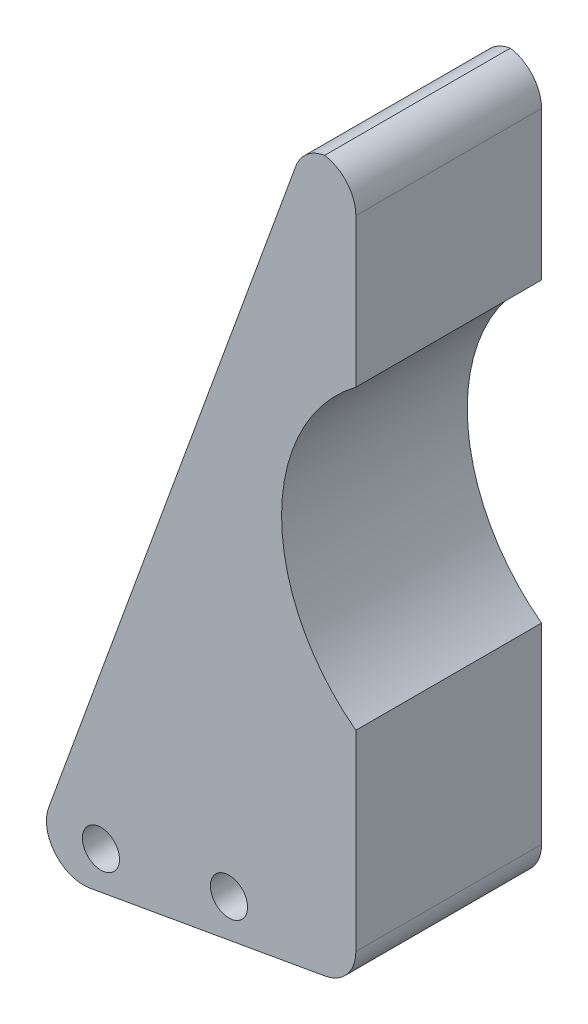
from build123d import *

# Parameters (mm, degrees)
SKETCH1_R           = 5
BOSS_EXTRUDE1_DEPTH = 50
FILLET2_R           = 10
SKETCH2_R           = 12.5
CUT_EXTRUDE2_DEPTH  = 10


with BuildPart() as part:
    # Sketch1 → Boss-Extrude1 (new body)
    with BuildSketch(Plane.XY):
        with BuildLine():
            Line((0, 0), (0, 60))
            ThreePointArc((0, 60), (-20, 100), (0, 140))
            Line((0, 140), (0, 190))
            Line((0, 190), (-13.790104149, 190))
            Line((-13.790104149, 190), (-88.632697771, -15.62833599))
            Line((-88.632697771, -15.62833599), (0, 0))
        make_face()
        with Locations((-68.632697771, -1.947530257)):
            Circle(SKETCH1_R, mode=Mode.SUBTRACT)
        with Locations((-34.164426416, 4.130155961)):
            Circle(SKETCH1_R, mode=Mode.SUBTRACT)
    extrude(amount=BOSS_EXTRUDE1_DEPTH)

    # Fillet2
    # the kernel refuses this fillet: 10 mm, written as the material it takes off along each edge
    with BuildSketch(Plane(origin=(0, 0, -20.977490779), x_dir=(0, 1, 0), z_dir=(0, 0, 1))) as fillet2_piece_1:
        with BuildLine():
            CenterArc((FILLET2_R * 0.839099631177, FILLET2_R), FILLET2_R, 190, 80)
            Line((-FILLET2_R * 0.145708121835, FILLET2_R * 0.826351822333), (0, 0))
            Line((0, 0), (FILLET2_R * 0.839099631177, 0))
        make_face()
    extrude(amount=91.954981559, mode=Mode.SUBTRACT)
    with BuildSketch(Plane(origin=(-88.632697771, -15.62833599, -43.301270189), x_dir=(0.34202014332567615, 0.9396926207859058, 0), z_dir=(0, 0, 1))) as fillet2_piece_2:
        with BuildLine():
            CenterArc((FILLET2_R * 1.73205080757, -FILLET2_R), FILLET2_R, 90, 120)
            Line((FILLET2_R * 0.866025403784, -FILLET2_R * 1.5), (0, 0))
            Line((0, 0), (FILLET2_R * 1.73205080757, 0))
        make_face()
    extrude(amount=136.602540378, mode=Mode.SUBTRACT)
    with BuildSketch(Plane(origin=(-13.790104149, 190, -17.505188455), x_dir=(1, 0, 0), z_dir=(0, 0, 1))) as fillet2_piece_3:
        with BuildLine():
            CenterArc((FILLET2_R * 0.70020753821, -FILLET2_R), FILLET2_R, 90, 70)
            Line((-FILLET2_R * 0.239485082576, -FILLET2_R * 0.657979856674), (0, 0))
            Line((0, 0), (FILLET2_R * 0.70020753821, 0))
        make_face()
    extrude(amount=85.01037691, mode=Mode.SUBTRACT)
    with BuildSketch(Plane(origin=(0, 190, -25), x_dir=(0, -1, 0), z_dir=(0, 0, 1))) as fillet2_piece_4:
        with BuildLine():
            CenterArc((FILLET2_R, -FILLET2_R), FILLET2_R, 90, 90)
            Line((0, -FILLET2_R), (0, 0))
            Line((0, 0), (FILLET2_R, 0))
        make_face()
    extrude(amount=100, mode=Mode.SUBTRACT)

    # Sketch2 → Cut-Extrude2 (cut, symmetric)
    with BuildSketch(Plane.XY.offset(25)):
        with Locations((-68.632697771, -1.947530257)):
            Circle(SKETCH2_R)
    extrude(amount=CUT_EXTRUDE2_DEPTH, both=True, mode=Mode.SUBTRACT)


solid = part.part
